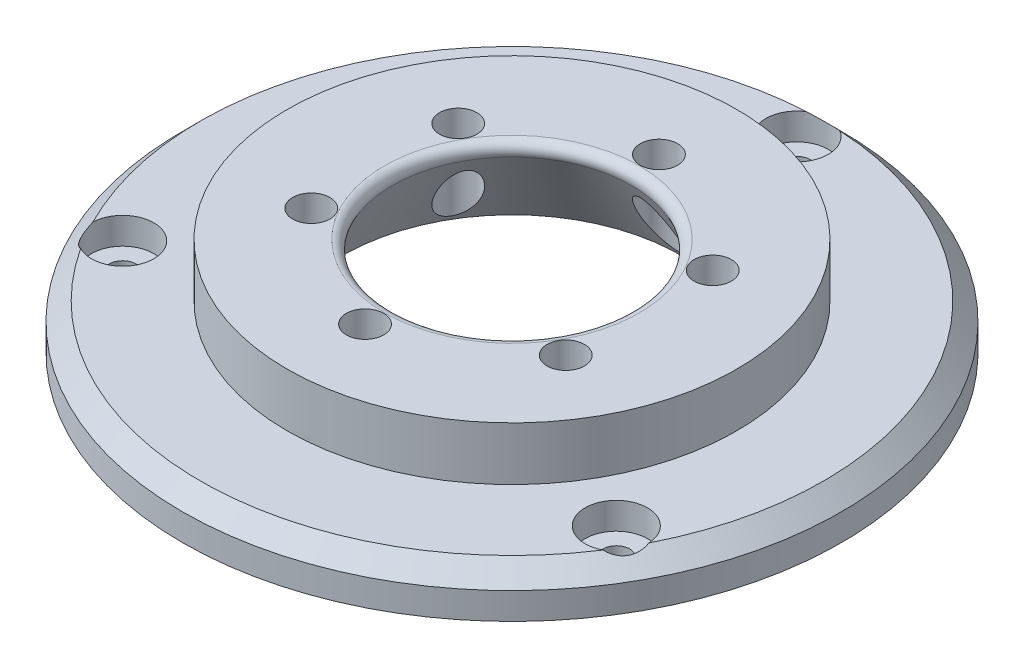
from build123d import *

# Parameters (mm, degrees)
SKETCH1_R           = 25.25
SKETCH1_R_2         = 12
BOSS_EXTRUDE1_DEPTH = 6
BOSS_EXTRUDE2_START = -5
SKETCH2_R           = 37
SKETCH2_R_2         = 12
BOSS_EXTRUDE2_DEPTH = 5
SKETCH3_R           = 1.5
CUT_EXTRUDE1_DEPTH  = 53.668776329
CUT_EXTRUDE2_START  = -3
SKETCH4_R           = 3.5
CUT_EXTRUDE2_DEPTH  = 56.668776329
CIRPATTERN1_COUNT   = 3
CHAMFER1_SIZE       = 12
CHAMFER1_SIZE_2     = 6.92820323
CHAMFER2_SIZE       = 2
SKETCH5_R           = 2.1
CUT_EXTRUDE3_DEPTH  = 54.46961768
CIRPATTERN2_COUNT   = 6
FILLET1_R           = 1


with BuildPart() as part:
    # Sketch1 → Boss-Extrude1 (new body)
    with BuildSketch(Plane(origin=(0, 0, 0), x_dir=(1, 0, 0), z_dir=(0, 1, 0))):
        with Locations(Location((0, 0, 0), (0, 0, 270))):
            Circle(SKETCH1_R)
        with Locations(Location((0, 0, 0), (0, 0, 270))):
            Circle(SKETCH1_R_2, mode=Mode.SUBTRACT)
    extrude(amount=BOSS_EXTRUDE1_DEPTH)

    # Sketch2 → Boss-Extrude2 (add)
    with BuildSketch(Plane(origin=(0, 0, 0), x_dir=(1, 0, 0), z_dir=(0, 1, 0)).offset(BOSS_EXTRUDE2_START)):
        with Locations(Location((0, 0, 0), (0, 0, 270))):
            Circle(SKETCH2_R)
        with Locations(Location((0, 0, 0), (0, 0, 270))):
            Circle(SKETCH2_R_2, mode=Mode.SUBTRACT)
    extrude(amount=BOSS_EXTRUDE2_DEPTH)

    # Sketch3 → Cut-Extrude1 (cut, through all)
    with BuildSketch(Plane(origin=(0, 0, 0), x_dir=(1, 0, 0), z_dir=(0, 1, 0))):
        with Locations(Location((0, 32, 0), (0, 0, 270))):
            Circle(SKETCH3_R)
    cut_extrude1 = extrude(amount=-CUT_EXTRUDE1_DEPTH, mode=Mode.SUBTRACT)

    # Sketch4 → Cut-Extrude2 (cut)
    with BuildSketch(Plane(origin=(0, 0, 0), x_dir=(1, 0, 0), z_dir=(0, 1, 0)).offset(CUT_EXTRUDE2_START)):
        with Locations(Location((0, 32, 0), (0, 0, 270))):
            Circle(SKETCH4_R)
    cut_extrude2 = extrude(amount=CUT_EXTRUDE2_DEPTH, mode=Mode.SUBTRACT)

    # CirPattern1: Cut-Extrude1, Cut-Extrude2 ×3 about axis
    cirpattern1_axis = Axis((0, 0, 0), (0, 1, 0))
    add([cut_extrude1.rotate(cirpattern1_axis, i * 360 / CIRPATTERN1_COUNT) for i in range(1, CIRPATTERN1_COUNT)], mode=Mode.SUBTRACT)
    add([cut_extrude2.rotate(cirpattern1_axis, i * 360 / CIRPATTERN1_COUNT) for i in range(1, CIRPATTERN1_COUNT)], mode=Mode.SUBTRACT)

    # Chamfer1
    # the kernel refuses this chamfer: 12, 6.92820323 mm, written as the material it takes off along each edge
    with BuildSketch(Plane(origin=(0, -5, 0), x_dir=(0, 0, 1), z_dir=(-1, 0, 0))) as chamfer1_piece_1:
        Polygon((12, CHAMFER1_SIZE), (12 + CHAMFER1_SIZE_2, 0), (12, 0), align=None)
    revolve(axis=Axis((0, -5, 0), (0, 1, 0)), mode=Mode.SUBTRACT)

    # Chamfer2
    # the kernel refuses this chamfer: 2 mm, written as the material it takes off along each edge
    with BuildSketch(Plane(origin=(0, 0, 0), x_dir=(0, 0, 1), z_dir=(-1, 0, 0))) as chamfer2_piece_1:
        Polygon((37 - CHAMFER2_SIZE, 0), (37, -CHAMFER2_SIZE), (37, 0), align=None)
    revolve(axis=Axis((0, 0, 0), (0, 1, 0)), mode=Mode.SUBTRACT)

    # Sketch5 → Cut-Extrude3 (cut, through all)
    with BuildSketch(Plane(origin=(0, 6, 0), x_dir=(1, 0, 0), z_dir=(0, 1, 0))):
        with Locations(Location((0, 16.5, 0), (0, 0, 270))):
            Circle(SKETCH5_R)
    cut_extrude3 = extrude(amount=-CUT_EXTRUDE3_DEPTH, mode=Mode.SUBTRACT)

    # CirPattern2: Cut-Extrude3 ×6 about axis
    cirpattern2_axis = Axis((0, 0, 0), (0, 1, 0))
    for i in range(1, CIRPATTERN2_COUNT):
        add(cut_extrude3.rotate(cirpattern2_axis, i * 360 / CIRPATTERN2_COUNT), mode=Mode.SUBTRACT)

    # Fillet1
    fillet1_edges = [part.edges().sort_by_distance(p)[0] for p in [
        (0, 6, -12.577350269),
    ]]
    fillet(fillet1_edges, radius=FILLET1_R)


solid = part.part
